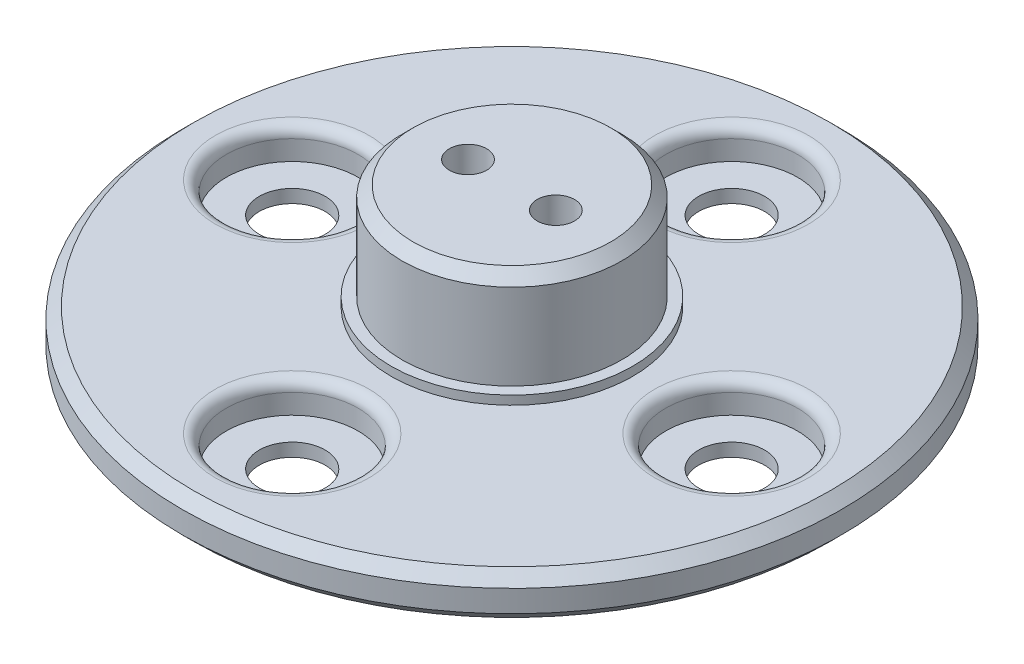
from build123d import *

# Parameters (mm, degrees)
SKETCH_1_R          = 15
SKETCH_1_R_2        = 1.5
EXTRUDE_1_DEPTH     = 2
SKETCH_2_R          = 5
SKETCH_2_R_2        = 0.85
EXTRUDE_2_DEPTH     = 4.8
SKETCH_4_R          = 5.5
EXTRUDE_3_DEPTH     = 0.4
CHAMFER_1_SIZE      = 0.5
CHAMFER_3_SIZE      = 0.5
SKETCH_5_R          = 3
CUT_EXTRUDE_1_DEPTH = 1.4
FILLET_1_R          = 0.5


with BuildPart() as part:
    # 草图1 → 凸台-拉伸1 (new body)
    with BuildSketch(Plane(origin=(0, 0, 0), x_dir=(1, 0, 0), z_dir=(0, 1, 0))):
        Circle(SKETCH_1_R)
        with Locations((0, 10)):
            Circle(SKETCH_1_R_2, mode=Mode.SUBTRACT)
        with Locations((10, 0)):
            Circle(SKETCH_1_R_2, mode=Mode.SUBTRACT)
        with Locations((0, -10)):
            Circle(SKETCH_1_R_2, mode=Mode.SUBTRACT)
        with Locations((-10, 0)):
            Circle(SKETCH_1_R_2, mode=Mode.SUBTRACT)
    extrude(amount=EXTRUDE_1_DEPTH)

    # 草图2 → 凸台-拉伸2 (add)
    with BuildSketch(Plane(origin=(0, 2, 0), x_dir=(1, 0, 0), z_dir=(0, 1, 0))):
        Circle(SKETCH_2_R)
        with Locations((2, 0)):
            Circle(SKETCH_2_R_2, mode=Mode.SUBTRACT)
        with Locations((-2, 0)):
            Circle(SKETCH_2_R_2, mode=Mode.SUBTRACT)
    extrude(amount=EXTRUDE_2_DEPTH)

    # 草图4 → 凸台-拉伸3 (add)
    with BuildSketch(Plane(origin=(0, 2, 0), x_dir=(1, 0, 0), z_dir=(0, 1, 0))):
        Circle(SKETCH_4_R)
    extrude(amount=EXTRUDE_3_DEPTH)

    # 倒角1
    chamfer_1_edges = [part.edges().sort_by_distance(p)[0] for p in [
        (-5, 6.8, 0),
    ]]
    chamfer(chamfer_1_edges, length=CHAMFER_1_SIZE)

    # 倒角3
    chamfer_3_edges = [part.edges().sort_by_distance(p)[0] for p in [
        (-15, 0, 0),
        (-15, 2, 0),
    ]]
    chamfer(chamfer_3_edges, length=CHAMFER_3_SIZE)

    # 草图5 → 切除-拉伸1 (cut)
    with BuildSketch(Plane(origin=(0, 2, 0), x_dir=(1, 0, 0), z_dir=(0, 1, 0))):
        with Locations((0, 10)):
            Circle(SKETCH_5_R)
        with Locations((10, 0)):
            Circle(SKETCH_5_R)
        with Locations((0, -10)):
            Circle(SKETCH_5_R)
        with Locations((-10, 0)):
            Circle(SKETCH_5_R)
    extrude(amount=-CUT_EXTRUDE_1_DEPTH, mode=Mode.SUBTRACT)

    # 圆角1
    fillet_1_edges = [part.edges().sort_by_distance(p)[0] for p in [
        (-3, 2, 10),
        (7, 2, 0),
        (-3, 2, -10),
        (-13, 2, 0),
    ]]
    fillet(fillet_1_edges, radius=FILLET_1_R)


solid = part.part
